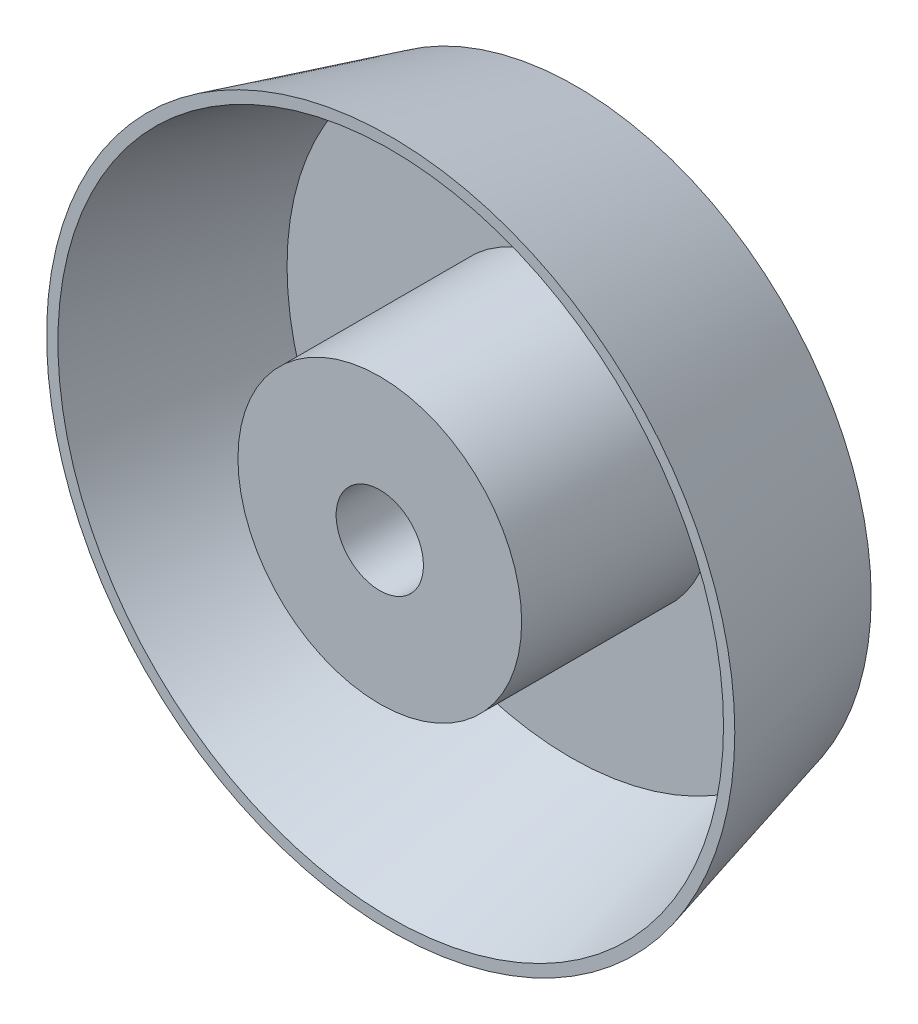
from build123d import *

# Parameters (mm, degrees)
SKETCH_1_R          = 26
SKETCH_1_R_2        = 13
EXTRUDE_1_DEPTH     = 0.5
SKETCH_7_R          = 13
SKETCH_7_R_2        = 4
BOSS_EXTRUDE1_DEPTH = 18


# Read off the part's stored shape, not the designer's step: По сечениям-Тонкостенный1
with BuildPart() as part:
    # Эскиз1 → Вытянуть1 (new body)
    with BuildSketch(Plane.XY):
        Circle(SKETCH_1_R)
        Circle(SKETCH_1_R_2, mode=Mode.SUBTRACT)
    extrude(amount=EXTRUDE_1_DEPTH)

    # Эскиз7 → Boss-Extrude1 (add)
    with BuildSketch(Plane.XY):
        Circle(SKETCH_7_R)
        Circle(SKETCH_7_R_2, mode=Mode.SUBTRACT)
    extrude(amount=BOSS_EXTRUDE1_DEPTH)


with BuildPart() as body_2:
    # По сечениям-Тонкостенный1 outline → По сечениям-Тонкостенный1 (revolve)
    with BuildSketch(Plane.XZ):
        Polygon((30.5, 17), (26, 0), (27.034441494, 0), (31.534441494, 17), align=None)
    revolve(axis=Axis((0, 0, 0), (0, 0, 1)))


solid = Compound([part.part, body_2.part])
